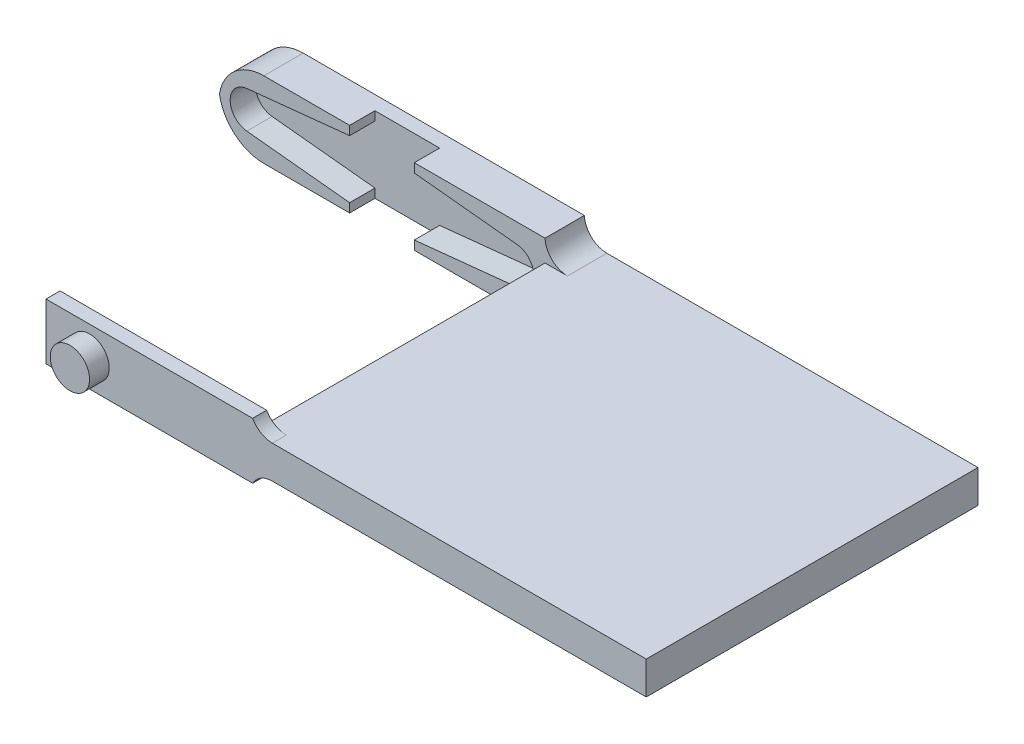
from build123d import *

# Parameters (mm, degrees)
SKETCH1_W            = 29
SKETCH1_H            = 6.75
BOSS_EXTRUDE10_DEPTH = 3.5
SKETCH1_16_R         = 0.291434634
BOSS_EXTRUDE15_DEPTH = 1.25
SKETCH1_17_W         = 35
SKETCH1_17_H         = 2.924143722
BOSS_EXTRUDE17_DEPTH = 29.5
BOSS_EXTRUDE18_DEPTH = 1.25
SKETCH2_9_R          = 1.75
BOSS_EXTRUDE19_DEPTH = 1.75
FILLET1_R            = 2
FILLET2_R            = 4
SKETCH3_W            = 5.75
SKETCH3_H            = 0.795101344
CUT_EXTRUDE1_DEPTH   = 2.25


with BuildPart() as part:
    # Sketch1 → Boss-Extrude10 (new body)
    with BuildSketch(Plane.XY):
        with Locations((0, 3.375)):
            Rectangle(SKETCH1_W, SKETCH1_H)
        with BuildLine():
            Line((-12.018477316, 5.016376067), (0, 6.25))
            Line((0, 6.25), (12.018477316, 5.016376067))
            ThreePointArc((12.018477316, 5.016376067), (13.5, 3.375), (12.018477316, 1.733623933))
            Line((12.018477316, 1.733623933), (0, 0.5))
            Line((0, 0.5), (-12.018477316, 1.733623933))
            ThreePointArc((-12.018477316, 1.733623933), (-13.5, 3.375), (-12.018477316, 5.016376067))
        make_face(mode=Mode.SUBTRACT)
    extrude(amount=BOSS_EXTRUDE10_DEPTH)

    # Sketch1<16> → Boss-Extrude15 (add)
    # profile 1 of 9: a face of its own
    with BuildSketch(Plane.XY):
        with BuildLine():
            Line((-0.584049273, 6.190050878), (-12.018477316, 5.016376067))
            ThreePointArc((-12.018477316, 5.016376067), (-13.5, 3.375), (-12.018477316, 1.733623933))
            Line((-12.018477316, 1.733623933), (-0.584049273, 0.559949122))
            ThreePointArc((-0.584049273, 0.559949122), (-2.875, 3.375), (-0.584049273, 6.190050878))
        make_face()
        with Locations((-11.85, 3.375)):
            Circle(SKETCH1_16_R, mode=Mode.SUBTRACT)
        with Locations((-9.813185408, 3.375)):
            Circle(SKETCH1_16_R, mode=Mode.SUBTRACT)
        with Locations((-7.776370816, 3.375)):
            Circle(SKETCH1_16_R, mode=Mode.SUBTRACT)
    # profile 2 of 9: a face of its own
    with BuildSketch(Plane.XY):
        with Locations((-11.85, 3.375)):
            Circle(SKETCH1_16_R)
    # profile 3 of 9: a face of its own
    with BuildSketch(Plane.XY):
        with Locations((-7.776370816, 3.375)):
            Circle(SKETCH1_16_R)
    # profile 4 of 9: a face of its own
    with BuildSketch(Plane.XY):
        with Locations((-9.813185408, 3.375)):
            Circle(SKETCH1_16_R)
    # profile 5 of 9: a face of its own
    with BuildSketch(Plane.XY):
        with BuildLine():
            Line((0, 6.25), (-0.584049273, 6.190050878))
            ThreePointArc((-0.584049273, 6.190050878), (-2.875, 3.375), (-0.584049273, 0.559949122))
            Line((-0.584049273, 0.559949122), (0, 0.5))
            Line((0, 0.5), (0.584049273, 0.559949122))
            ThreePointArc((0.584049273, 0.559949122), (2.229884152, 1.56027091), (2.875, 3.375))
            ThreePointArc((2.875, 3.375), (2.229884152, 5.18972909), (0.584049273, 6.190050878))
            Line((0.584049273, 6.190050878), (0, 6.25))
        make_face()
    # profile 6 of 9: a face of its own
    with BuildSketch(Plane.XY):
        with BuildLine():
            Line((12.018477316, 5.016376067), (0.584049273, 6.190050878))
            ThreePointArc((0.584049273, 6.190050878), (2.229884152, 5.18972909), (2.875, 3.375))
            ThreePointArc((2.875, 3.375), (2.229884152, 1.56027091), (0.584049273, 0.559949122))
            Line((0.584049273, 0.559949122), (12.018477316, 1.733623933))
            ThreePointArc((12.018477316, 1.733623933), (13.5, 3.375), (12.018477316, 5.016376067))
        make_face()
        with Locations((7.776370816, 3.375)):
            Circle(SKETCH1_16_R, mode=Mode.SUBTRACT)
        with Locations((9.813185408, 3.375)):
            Circle(SKETCH1_16_R, mode=Mode.SUBTRACT)
        with Locations((11.85, 3.375)):
            Circle(SKETCH1_16_R, mode=Mode.SUBTRACT)
    # profile 7 of 9: a face of its own
    with BuildSketch(Plane.XY):
        with Locations((11.85, 3.375)):
            Circle(SKETCH1_16_R)
    # profile 8 of 9: a face of its own
    with BuildSketch(Plane.XY):
        with Locations((9.813185408, 3.375)):
            Circle(SKETCH1_16_R)
    # profile 9 of 9: a face of its own
    with BuildSketch(Plane.XY):
        with Locations((7.776370816, 3.375)):
            Circle(SKETCH1_16_R)
    extrude(amount=BOSS_EXTRUDE15_DEPTH)

    # Sketch1<17> → Boss-Extrude17 (add)
    with BuildSketch(Plane.XY):
        with Locations((32, 3.375)):
            Rectangle(SKETCH1_17_W, SKETCH1_17_H)
    extrude(amount=BOSS_EXTRUDE17_DEPTH)

    # Sketch2 → Boss-Extrude18 (add)
    with BuildSketch(Plane.XY.offset(29.5)):
        Polygon((13.5, 5.875), (-3.875, 5.875), (-3.875, 0.875), (14.5, 0.875), (14.5, 5.875), align=None)
    extrude(amount=-BOSS_EXTRUDE18_DEPTH)

    # Sketch2<9> → Boss-Extrude19 (add)
    with BuildSketch(Plane.XY.offset(29.5)):
        with Locations((0, 3.375)):
            Circle(SKETCH2_9_R)
    extrude(amount=BOSS_EXTRUDE19_DEPTH)

    # Fillet1
    # the kernel refuses this fillet: 2 mm, written as the material it adds along each edge
    with BuildSketch(Plane(origin=(14.5, 1.912928139, 0), x_dir=(0, -1, 0), z_dir=(0, 0, 1))) as fillet1_piece_1:
        with BuildLine():
            CenterArc((2, 1.998103724), FILLET1_R, 180, 87.504786267)
            Line((0, 1.998103724), (0, 0))
            Line((0, 0), (1.912928139, 0))
        make_face()
    extrude(amount=3.5)
    with BuildSketch(Plane(origin=(14.5, 4.837071861, 0), x_dir=(1, 0, 0), z_dir=(0, 0, 1))) as fillet1_piece_2:
        with BuildLine():
            CenterArc((1.998103724, 2), FILLET1_R, 182.495213733, 87.504786267)
            Line((0, 1.912928139), (0, 0))
            Line((0, 0), (1.998103724, 0))
        make_face()
    extrude(amount=3.5)
    with BuildSketch(Plane(origin=(14.5, 1.912928139, 28.25), x_dir=(1, 0, 0), z_dir=(0, 0, 1))) as fillet1_piece_3:
        with BuildLine():
            CenterArc((1.753401761, -2), FILLET1_R, 90, 61.246917848)
            Line((0, -1.037928139), (0, 0))
            Line((0, 0), (1.753401761, 0))
        make_face()
    extrude(amount=1.25)
    with BuildSketch(Plane(origin=(14.5, 4.837071861, 28.25), x_dir=(1, 0, 0), z_dir=(0, 0, 1))) as fillet1_piece_4:
        with BuildLine():
            CenterArc((1.753401761, 2), FILLET1_R, 208.753082152, 61.246917848)
            Line((0, 1.037928139), (0, 0))
            Line((0, 0), (1.753401761, 0))
        make_face()
    extrude(amount=1.25)

    # Fillet2
    # the kernel refuses this fillet: 4 mm, written as the material it takes off along each edge
    with BuildSketch(Plane(origin=(-14.5, 6.75, -10), x_dir=(0, -1, 0), z_dir=(0, 0, 1)), Plane(origin=(-14.5, 0, -10), x_dir=(1, 0, 0), z_dir=(0, 0, 1))) as fillet2_piece_1:
        with BuildLine():
            CenterArc((FILLET2_R, FILLET2_R), FILLET2_R, 180, 90)
            Line((0, FILLET2_R), (0, 0))
            Line((0, 0), (FILLET2_R, 0))
        make_face()
    extrude(amount=23.5, mode=Mode.SUBTRACT)

    # Sketch3 → Cut-Extrude1 (cut)
    with BuildSketch(Plane.XY.offset(3.5)):
        with Locations((0, 0.397550672)):
            Rectangle(SKETCH3_W, SKETCH3_H)
        with Locations((0, 6.352449328)):
            Rectangle(SKETCH3_W, SKETCH3_H)
    extrude(amount=-CUT_EXTRUDE1_DEPTH, mode=Mode.SUBTRACT)


solid = part.part
